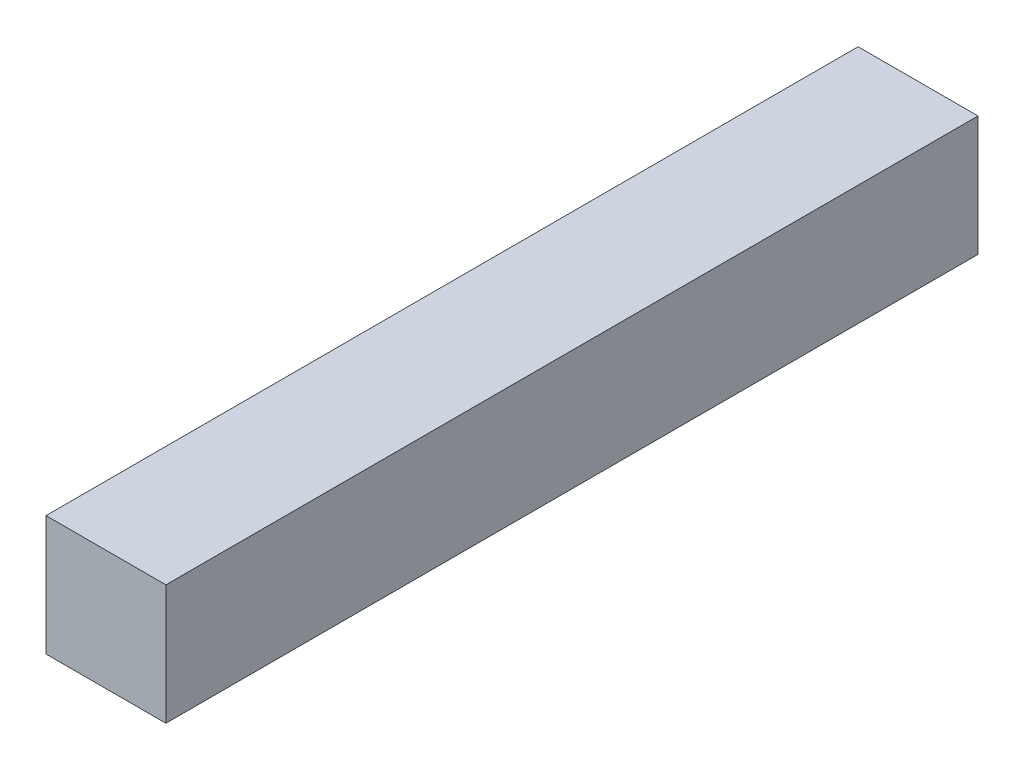
from build123d import *

# Parameters (mm, degrees)
SKETCH1_W           = 30
SKETCH1_H           = 30
BOSS_EXTRUDE1_DEPTH = 203.2


with BuildPart() as part:
    # Sketch1 → Boss-Extrude1 (new body)
    with BuildSketch(Plane.XY):
        Rectangle(SKETCH1_W, SKETCH1_H)
    extrude(amount=BOSS_EXTRUDE1_DEPTH)


solid = part.part
